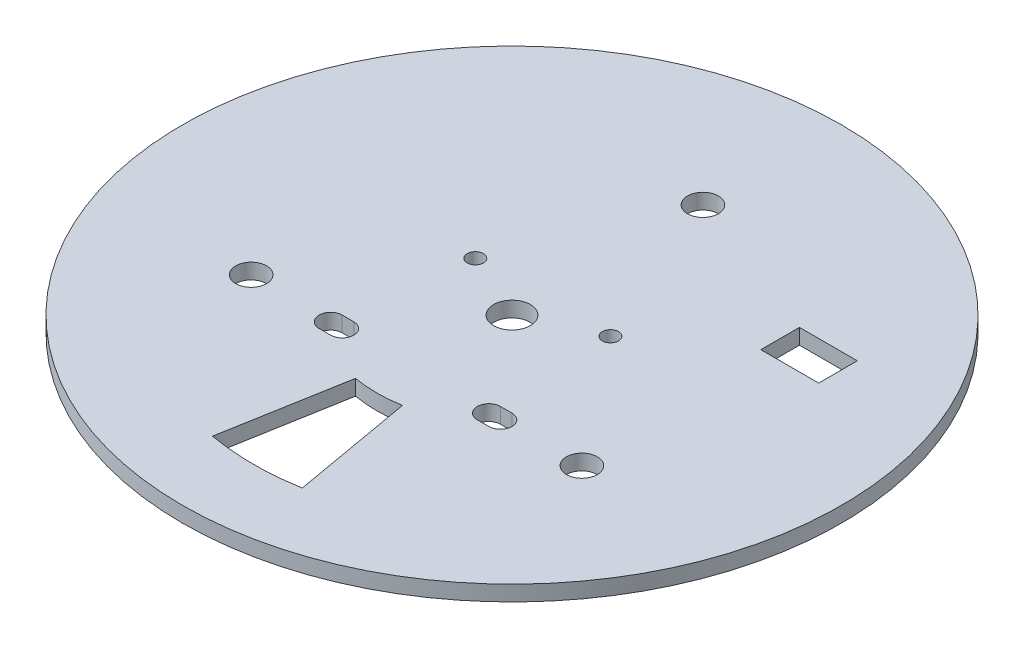
from build123d import *

# Parameters (mm, degrees)
ESBO_O1_R                = 85.4
RESSALTO_EXTRUS_O1_DEPTH = 4
CORTE_EXTRUS_O2_DEPTH    = 121.840059583
ESBO_O4_R                = 4
CORTE_EXTRUS_O3_DEPTH    = 121.840059583
ESBO_O5_R                = 4.75
CORTE_EXTRUS_O4_DEPTH    = 121.840059583
ESBO_O7_R                = 2.1
CORTE_EXTRUS_O5_DEPTH    = 121.840059583
CORTE_EXTRUS_O6_REACH    = 122.84
ESBO_O8_W                = 15
ESBO_O8_H                = 10


with BuildPart() as part:
    # Esboço1 → Ressalto-extrusão1 (new body)
    with BuildSketch(Plane(origin=(0, 0, 0), x_dir=(1, 0, 0), z_dir=(0, 1, 0))):
        Circle(ESBO_O1_R)
    extrude(amount=RESSALTO_EXTRUS_O1_DEPTH)

    # Esboço3 → Corte-extrusão2 (cut, through all)
    with BuildSketch(Plane.XZ):
        with BuildLine():
            Line((6.077686218, 34.468271355), (11.634427904, 65.982119452))
            ThreePointArc((11.634427904, 65.982119452), (0, 67), (-11.634427904, 65.982119452))
            Line((-11.634427904, 65.982119452), (-6.077686218, 34.468271355))
            ThreePointArc((-6.077686218, 34.468271355), (0, 35), (6.077686218, 34.468271355))
        make_face()
    extrude(amount=-CORTE_EXTRUS_O2_DEPTH, mode=Mode.SUBTRACT)

    # Esboço4 → Corte-extrusão3 (cut, through all)
    with BuildSketch(Plane(origin=(0, 4, 0), x_dir=(1, 0, 0), z_dir=(0, 1, 0))):
        with Locations((42.850936979, -24.74)):
            Circle(ESBO_O4_R)
        with Locations((0, 49.48)):
            Circle(ESBO_O4_R)
        with Locations((-42.850936979, -24.74)):
            Circle(ESBO_O4_R)
    extrude(amount=-CORTE_EXTRUS_O3_DEPTH, mode=Mode.SUBTRACT)

    # Esboço5 → Corte-extrusão4 (cut, through all)
    with BuildSketch(Plane.XZ):
        Circle(ESBO_O5_R)
    extrude(amount=-CORTE_EXTRUS_O4_DEPTH, mode=Mode.SUBTRACT)

    # Esboço7 → Corte-extrusão5 (cut, through all)
    with BuildSketch(Plane(origin=(0, 4, 0), x_dir=(1, 0, 0), z_dir=(0, 1, 0))):
        with Locations((-17.5, 8)):
            Circle(ESBO_O7_R)
        with Locations((17.5, 8)):
            Circle(ESBO_O7_R)
        with BuildLine():
            Line((-22, -22), (-19, -22))
            ThreePointArc((-19, -22), (-16, -25), (-19, -28))
            Line((-19, -28), (-22, -28))
            ThreePointArc((-22, -28), (-25, -25), (-22, -22))
        make_face()
        with BuildLine():
            Line((19, -28), (22, -28))
            ThreePointArc((22, -28), (25, -25), (22, -22))
            Line((22, -22), (19, -22))
            ThreePointArc((19, -22), (16, -25), (19, -28))
        make_face()
    extrude(amount=-CORTE_EXTRUS_O5_DEPTH, mode=Mode.SUBTRACT)

    # Esboço8 → Corte-extrusão6 (cut, up to next)
    with BuildSketch(Plane(origin=(0, 4, 0), x_dir=(1, 0, 0), z_dir=(0, 1, 0)), mode=Mode.PRIVATE) as corte_extrus_o6_sk1:
        with Locations((47.5, 29.48)):
            Rectangle(ESBO_O8_W, ESBO_O8_H)
    corte_extrus_o6_tool1 = extrude(corte_extrus_o6_sk1.sketch, amount=-CORTE_EXTRUS_O6_REACH, mode=Mode.PRIVATE) & part.part
    add(corte_extrus_o6_tool1.solids().sort_by_distance((47.5, 4, -29.48))[0], mode=Mode.SUBTRACT)


solid = part.part
